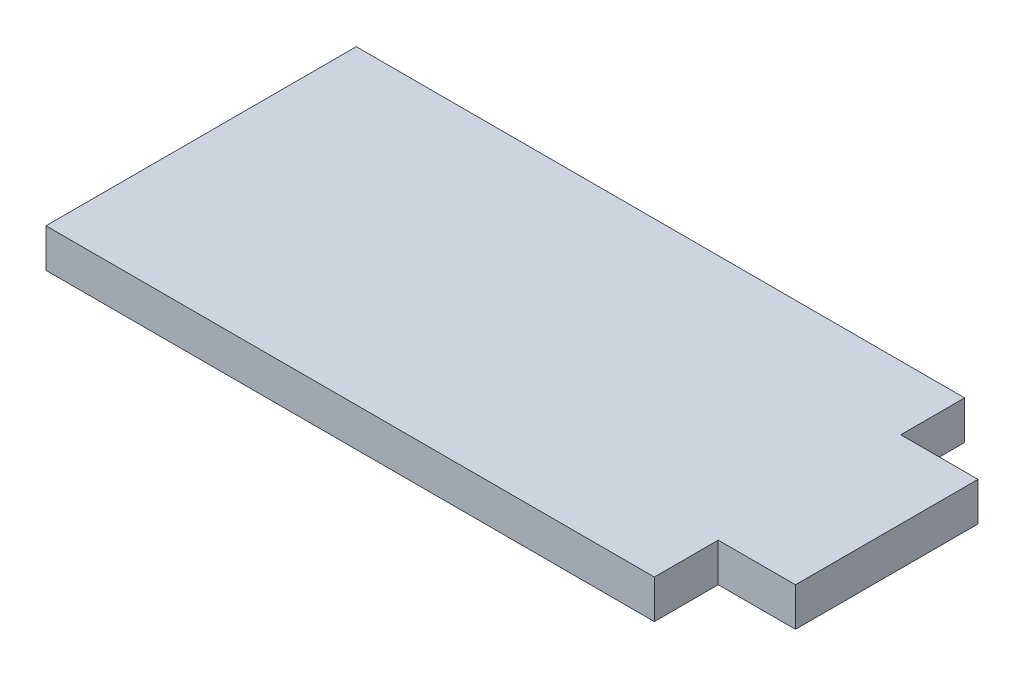
from build123d import *

# Parameters (mm, degrees)
BOSS_EXTRUDE1_DEPTH = 3.175


with BuildPart() as part:
    # Sketch1 → Boss-Extrude1 (new body)
    with BuildSketch(Plane(origin=(0, 0, 0), x_dir=(1, 0, 0), z_dir=(0, 1, 0))):
        Polygon((25, 5.25), (-25, 5.25), (-25, 0), (-25, -15), (-25, -20.25), (25, -20.25), (25, -15), (31.35, -15), (31.35, 0), (25, 0), align=None)
    extrude(amount=BOSS_EXTRUDE1_DEPTH)


solid = part.part
